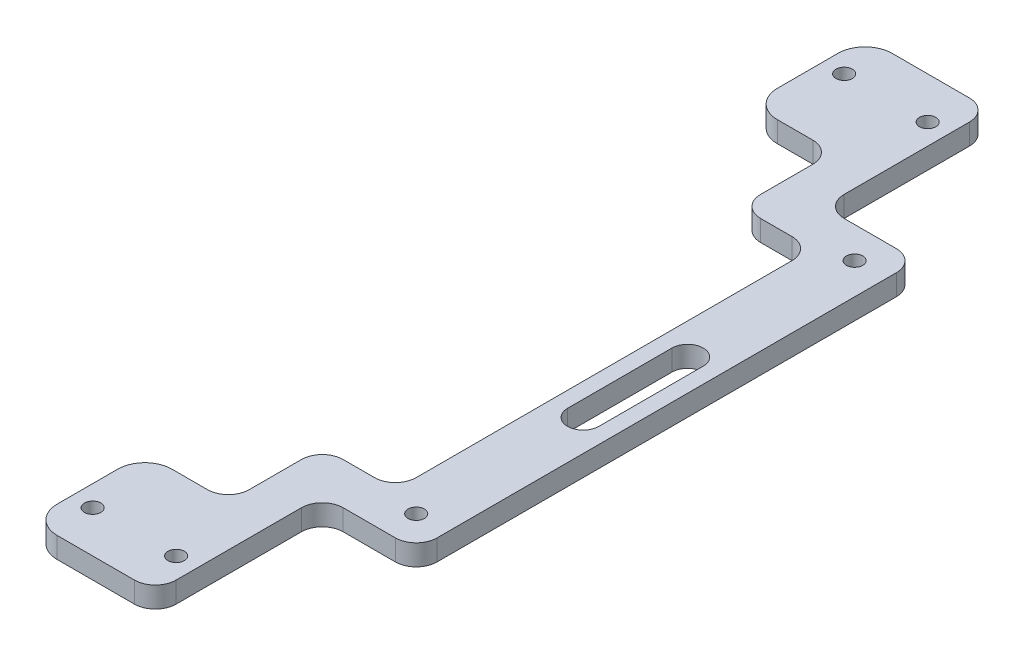
from build123d import *

# Parameters (mm, degrees)
SKETCH1_R           = 2.4892
BOSS_EXTRUDE1_DEPTH = 3.175
FILLET1_R           = 6.35
LPATTERN1_START     = -3.175
LPATTERN1_OUTLINE_R = 2.4892
LPATTERN1_DEPTH     = 6.35
SKETCH2_R           = 2.4892
SKETCH2_W           = 193.675
SKETCH2_H           = 254
CUT_EXTRUDE1_DEPTH  = 344.912740568
FILLET2_R           = 8.255


# Read off the part's stored shape, not the designer's step: LPattern1
with BuildPart() as part:
    # Sketch1 → Boss-Extrude1 (new, symmetric)
    with BuildSketch(Plane(origin=(0, 0, 0), x_dir=(1, 0, 0), z_dir=(0, 1, 0))):
        Polygon((0, 50.8), (0, 0), (203.2, 0), (203.2, 50.8), (231.775, 50.8), (231.775, 203.2), (203.2, 203.2), (203.2, 254), (0, 254), (0, 203.2), (-28.575, 203.2), (-28.575, 50.8), align=None)
        with Locations(Location((196.85, 12.7, 0), (0, 0, 270))):
            Circle(SKETCH1_R, mode=Mode.SUBTRACT)
        Polygon((12.7, 190.5), (12.7, 219.075), (190.5, 219.075), (190.5, 190.5), (212.725, 190.5), (212.725, 63.5), (190.5, 63.5), (190.5, 34.925), (12.7, 34.925), (12.7, 63.5), (-9.525, 63.5), (-9.525, 190.5), align=None, mode=Mode.SUBTRACT)
        with BuildLine():
            Line((227.0125, 142.875), (227.0125, 111.125))
            ThreePointArc((227.0125, 111.125), (222.25, 106.3625), (217.4875, 111.125))
            Line((217.4875, 111.125), (217.4875, 142.875))
            ThreePointArc((217.4875, 142.875), (222.25, 147.6375), (227.0125, 142.875))
        make_face(mode=Mode.SUBTRACT)
        with BuildLine():
            ThreePointArc((-14.2875, 111.125), (-19.05, 106.3625), (-23.8125, 111.125))
            Line((-23.8125, 111.125), (-23.8125, 142.875))
            ThreePointArc((-23.8125, 142.875), (-19.05, 147.6375), (-14.2875, 142.875))
            Line((-14.2875, 142.875), (-14.2875, 111.125))
        make_face(mode=Mode.SUBTRACT)
        with Locations(Location((196.85, 241.3, 0), (0, 0, 270))):
            Circle(SKETCH1_R, mode=Mode.SUBTRACT)
    extrude(amount=BOSS_EXTRUDE1_DEPTH, both=True)

    # Fillet1
    fillet1_edges = [part.edges().sort_by_distance(p)[0] for p in [
        (0, 0, 0),
        (0, 0, -50.8),
        (-28.575, 0, -50.8),
        (-28.575, 0, -203.2),
        (0, 0, -203.2),
        (0, 0, -254),
        (203.2, 0, -254),
        (203.2, 0, -203.2),
        (231.775, 0, -203.2),
        (231.775, 0, -50.8),
        (203.2, 0, -50.8),
        (203.2, 0, 0),
        (212.725, 0, -190.5),
        (190.5, 0, -190.5),
        (190.5, 0, -219.075),
        (12.7, 0, -219.075),
        (12.7, 0, -190.5),
        (-9.525, 0, -190.5),
        (-9.525, 0, -63.5),
        (12.7, 0, -63.5),
        (12.7, 0, -34.925),
        (190.5, 0, -34.925),
        (190.5, 0, -63.5),
        (212.725, 0, -63.5),
    ]]
    fillet(fillet1_edges, radius=FILLET1_R)

    # LPattern1 outline → LPattern1 (cut)
    with BuildSketch(Plane(origin=(0, 0, 0), x_dir=(1, 0, 0), z_dir=(0, 1, 0)).offset(LPATTERN1_START)):
        with Locations((19.05, 12.7)):
            Circle(LPATTERN1_OUTLINE_R)
        with Locations((19.05, 241.3)):
            Circle(LPATTERN1_OUTLINE_R)
        with Locations((44.45, 12.7)):
            Circle(LPATTERN1_OUTLINE_R)
        with Locations((44.45, 241.3)):
            Circle(LPATTERN1_OUTLINE_R)
        with Locations((69.85, 12.7)):
            Circle(LPATTERN1_OUTLINE_R)
        with Locations((69.85, 241.3)):
            Circle(LPATTERN1_OUTLINE_R)
        with Locations((95.25, 12.7)):
            Circle(LPATTERN1_OUTLINE_R)
        with Locations((95.25, 241.3)):
            Circle(LPATTERN1_OUTLINE_R)
        with Locations((120.65, 12.7)):
            Circle(LPATTERN1_OUTLINE_R)
        with Locations((120.65, 241.3)):
            Circle(LPATTERN1_OUTLINE_R)
        with Locations((146.05, 12.7)):
            Circle(LPATTERN1_OUTLINE_R)
        with Locations((146.05, 241.3)):
            Circle(LPATTERN1_OUTLINE_R)
        with Locations((171.45, 12.7)):
            Circle(LPATTERN1_OUTLINE_R)
        with Locations((171.45, 241.3)):
            Circle(LPATTERN1_OUTLINE_R)
    extrude(amount=LPATTERN1_DEPTH, mode=Mode.SUBTRACT)

    # Sketch2 → Cut-Extrude1 (cut, through all)
    with BuildSketch(Plane(origin=(0, 3.175, 0), x_dir=(1, 0, 0), z_dir=(0, 1, 0))):
        with Locations(Location((222.25, 193.675, 0), (0, 0, 270))):
            Circle(SKETCH2_R)
        with Locations(Location((222.25, 60.325, 0), (0, 0, 270))):
            Circle(SKETCH2_R)
        with Locations((68.2625, 127)):
            Rectangle(SKETCH2_W, SKETCH2_H)
    extrude(amount=-CUT_EXTRUDE1_DEPTH, mode=Mode.SUBTRACT)

    # Fillet2
    fillet2_edges = [part.edges().sort_by_distance(p)[0] for p in [
        (165.1, 0, -34.925),
        (165.1, 0, -219.075),
        (165.1, 0, -254),
        (165.1, 0, 0),
    ]]
    fillet(fillet2_edges, radius=FILLET2_R)


solid = part.part
